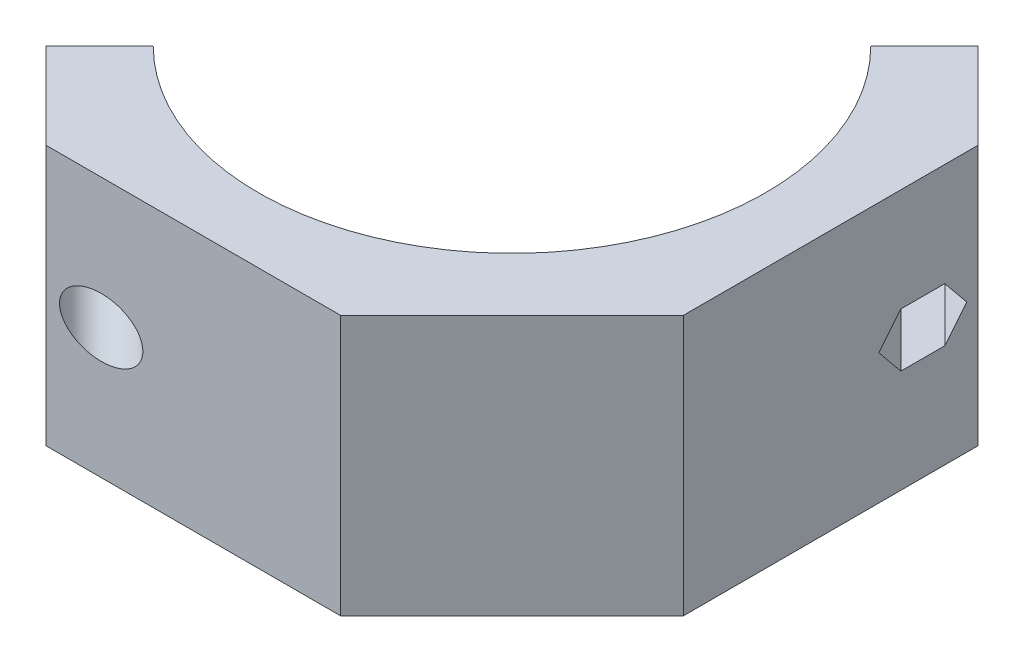
from build123d import *

# Parameters (mm, degrees)
BOSS_EXTRUDE1_DEPTH  = 25.4
CUT_SWEEP1_START     = 4.000000128
CUT_SWEEP1_OUTLINE_R = 5.750000057
CUT_SWEEP1_DEPTH     = 33.044274766
CUT_SWEEP2_PROFILE_R = 3.499999985
CUT_EXTRUDE1_DEPTH   = 88.74529292


# Read off the part's stored shape, not the designer's step: Cut-Sweep1
with BuildPart() as part:
    # Sketch1 → Boss-Extrude1 (new, symmetric)
    with BuildSketch(Plane(origin=(0, 0, 0), x_dir=(1, 0, 0), z_dir=(0, 1, 0))):
        Polygon((-37.260478906, -42.917333336), (-40.088906121, -40.088906121), (-45.477059794, -45.477059794), (-28.736819587, -62.2173), (-17.960512242, -62.2173), align=None)
        with BuildLine():
            ThreePointArc((35.014018616, -35.014018616), (0, -49.5173), (-35.014018616, -35.014018616))
            Line((-35.014018616, -35.014018616), (-40.088906121, -40.088906121))
            Line((-40.088906121, -40.088906121), (-37.260478906, -42.917333336))
            Line((-37.260478906, -42.917333336), (-17.960512242, -62.2173))
            Line((-17.960512242, -62.2173), (0, -62.2173))
            Line((0, -62.2173), (28.736819587, -62.2173))
            Line((28.736819587, -62.2173), (45.477059794, -45.477059794))
            Line((45.477059794, -45.477059794), (35.014018616, -35.014018616))
        make_face()
        with BuildLine():
            Line((42.917333336, 37.260478906), (40.088906121, 40.088906121))
            Line((40.088906121, 40.088906121), (35.014018616, 35.014018616))
            ThreePointArc((35.014018616, 35.014018616), (45.748019975, 18.949450325), (49.5173, 0))
            ThreePointArc((49.5173, 0), (45.748019975, -18.949450325), (35.014018616, -35.014018616))
            Line((35.014018616, -35.014018616), (45.477059794, -45.477059794))
            Line((45.477059794, -45.477059794), (62.2173, -28.736819587))
            Line((62.2173, -28.736819587), (62.2173, 0))
            Line((62.2173, 0), (62.2173, 17.960512242))
            Line((62.2173, 17.960512242), (42.917333336, 37.260478906))
        make_face()
        Polygon((62.2173, 28.736819587), (45.477059794, 45.477059794), (40.088906121, 40.088906121), (42.917333336, 37.260478906), (62.2173, 17.960512242), align=None)
    extrude(amount=BOSS_EXTRUDE1_DEPTH, both=True)

    # Cut-Sweep1 outline → Cut-Sweep1 (cut)
    with BuildSketch(Plane(origin=(0, 0, 0), x_dir=(0.7071067811865471, 0, -0.707106781186548), z_dir=(0.707106781186548, 0, 0.707106781186547)).offset(CUT_SWEEP1_START)):
        with Locations((-56.694274737, 0)):
            Circle(CUT_SWEEP1_OUTLINE_R)
    extrude(amount=CUT_SWEEP1_DEPTH, mode=Mode.SUBTRACT)

    # Cut-Sweep2: sweep along a path in Sketch44
    with BuildLine(Plane(origin=(0, 0, 0), x_dir=(1, 0, 0), z_dir=(0, 1, 0))) as cut_sweep2_path:
        Line((-40.088906121, -40.088906121), (-37.260478906, -42.917333336))
    # Cut-Sweep2 profile (on start of the path) → Cut-Sweep2 (sweep, cut)
    with BuildSketch(Plane(origin=(-40.088906121, 0, 40.088906121), x_dir=(0.7071067811865493, 0, -0.7071067811865458), z_dir=(0.7071067811865458, 0, 0.7071067811865493))):
        Circle(CUT_SWEEP2_PROFILE_R)
    cut_sweep2 = sweep(path=cut_sweep2_path.line, mode=Mode.SUBTRACT)

    # Mirror1: Cut-Sweep2 across plane
    add(cut_sweep2.mirror(Plane(origin=(0, 0, 0), x_dir=(0.7071067811865477, 0, 0.7071067811865474), z_dir=(-0.7071067811865476, 0, 0.7071067811865476))), mode=Mode.SUBTRACT)

    # Sketch53 → Cut-Extrude1 (cut, through all)
    with BuildSketch(Plane(origin=(2.828427215, 0, 2.828427215), x_dir=(-0.7071067811865427, 0, 0.7071067811865525), z_dir=(-0.7071067811865525, 0, -0.7071067811865427))):
        Polygon((-62.756452611, 0), (-59.725363674, -5.250000041), (-53.6631858, -5.250000041), (-50.632096863, 0), (-53.6631858, 5.250000041), (-59.725363674, 5.250000041), align=None)
    extrude(amount=-CUT_EXTRUDE1_DEPTH, mode=Mode.SUBTRACT)


solid = part.part
